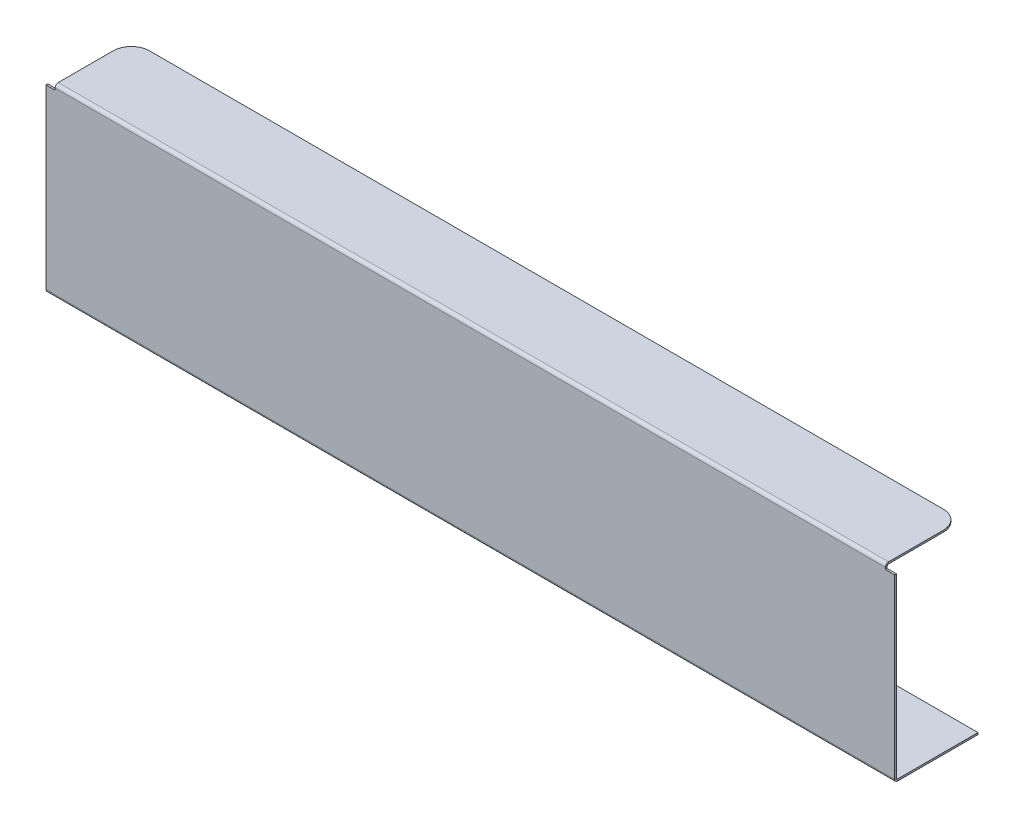
from build123d import *

# Parameters (mm, degrees)
BASE_FLANGE1_DEPTH     = 1
SKETCHED_START         = -232.5
SKETCHED_BEND1_DEPTH   = 465
SKETCHED_START_2       = -227.5
SKETCHED_BEND1_2_DEPTH = 455
SKETCHED_BEND1_3_DEPTH = 465
FILLET1_R              = 10


# Read off the part's stored shape, not the designer's step: Sketched Bend1
# Sheet-metal steps are written as plain solids
with BuildPart() as part:
    # Sketch1 → Base-Flange1 (new body)
    with BuildSketch(Plane.XY):
        Polygon((-227.5, 93), (-227.5, 50), (-232.5, 50), (-232.5, -93), (232.5, -93), (232.5, 50), (227.5, 50), (227.5, 93), align=None)
    extrude(amount=-BASE_FLANGE1_DEPTH)

    # Sketched Bend1 outline → Sketched Bend1 (cut)
    with BuildSketch(Plane.YZ.offset(SKETCHED_START)):
        with BuildLine():
            ThreePointArc((51.028776631, 0), (51.960602795, -0.271171885), (52.601417721, -1))
            Line((52.601417721, -1), (93, -1))
            Line((93, -1), (93, 0))
            Line((93, 0), (51.028776631, 0))
        make_face()
        with BuildLine():
            Line((-93, -1), (-48.601417721, -1))
            ThreePointArc((-48.601417721, -1), (-47.960602795, -0.271171885), (-47.028776631, 0))
            Line((-47.028776631, 0), (-93, 0))
            Line((-93, 0), (-93, -1))
        make_face()
    extrude(amount=SKETCHED_BEND1_DEPTH, mode=Mode.SUBTRACT)

    # Sketched Bend1 2 outline → Sketched Bend1 2 (add)
    with BuildSketch(Plane.YZ.offset(SKETCHED_START_2)):
        with BuildLine():
            ThreePointArc((51.028776631, -1), (51.549631486, -1.215745145), (51.765376631, -1.7366))
            Line((51.765376631, -1.7366), (51.765376631, -41.765376631))
            Line((51.765376631, -41.765376631), (52.765376631, -41.765376631))
            Line((52.765376631, -41.765376631), (52.765376631, -1.7366))
            ThreePointArc((52.765376631, -1.7366), (52.723891388, -1.359286442), (52.601417721, -1))
            Line((52.601417721, -1), (51.028776631, -1))
        make_face()
        with BuildLine():
            ThreePointArc((-47.765376631, -1.7366), (-47.549631486, -1.215745145), (-47.028776631, -1))
            Line((-47.028776631, -1), (-48.601417721, -1))
            ThreePointArc((-48.601417721, -1), (-48.723891388, -1.359286442), (-48.765376631, -1.7366))
            Line((-48.765376631, -1.7366), (-48.765376631, -45.765376631))
            Line((-48.765376631, -45.765376631), (-47.765376631, -45.765376631))
            Line((-47.765376631, -45.765376631), (-47.765376631, -1.7366))
        make_face()
    extrude(amount=SKETCHED_BEND1_2_DEPTH)

    # Sketched Bend1 3 outline → Sketched Bend1 3 (add)
    with BuildSketch(Plane.YZ.offset(SKETCHED_START)):
        with BuildLine():
            ThreePointArc((-47.765376631, -1.7366), (-47.549631486, -1.215745145), (-47.028776631, -1))
            Line((-47.028776631, -1), (-48.601417721, -1))
            ThreePointArc((-48.601417721, -1), (-48.723891388, -1.359286442), (-48.765376631, -1.7366))
            Line((-48.765376631, -1.7366), (-48.765376631, -45.765376631))
            Line((-48.765376631, -45.765376631), (-47.765376631, -45.765376631))
            Line((-47.765376631, -45.765376631), (-47.765376631, -1.7366))
        make_face()
    extrude(amount=SKETCHED_BEND1_3_DEPTH)

    # Fillet1
    fillet1_edges = [part.edges().sort_by_distance(p)[0] for p in [
        (-227.5, 52.265376631, -41.765376631),
        (227.5, 52.265376631, -41.765376631),
    ]]
    fillet(fillet1_edges, radius=FILLET1_R)


solid = part.part
